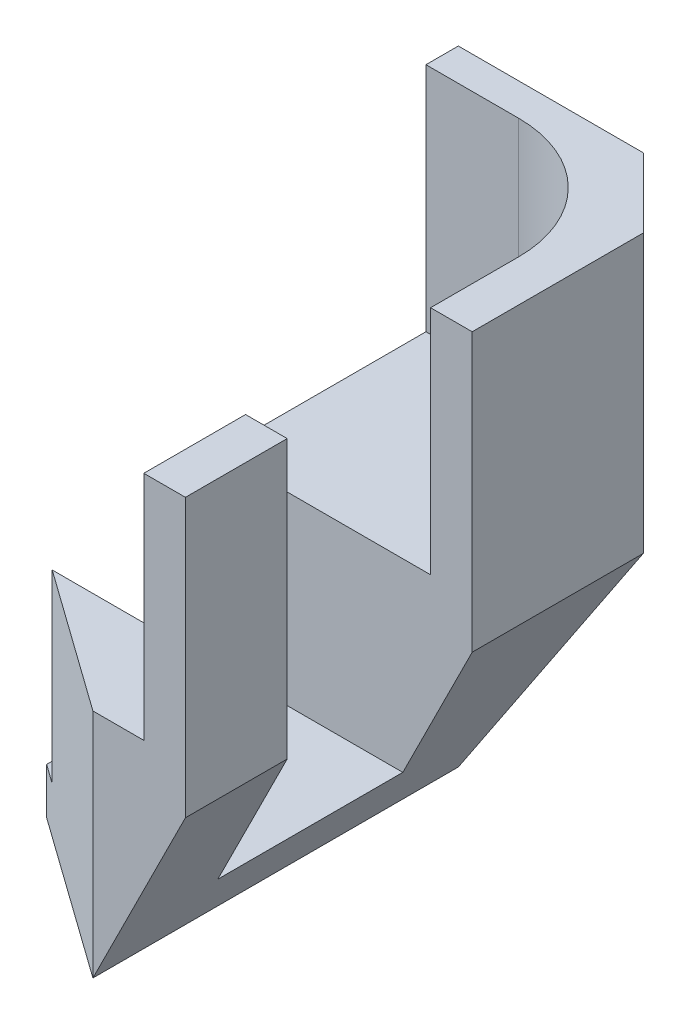
from build123d import *

# Parameters (mm, degrees)
SKETCH_1_R          = 2
EXTRUDE_1_DEPTH     = 50
CHAMFER_1_SIZE      = 15
EXTRUDE_2_DEPTH     = 50
CUT_EXTRUDE_START   = -40
SKETCH_3_W          = 55
SKETCH_3_H          = 40
CUT_EXTRUDE_1_DEPTH = 90
CUT_EXTRUDE_2_DEPTH = 156.630973781
CUT_EXTRUDE_3_DEPTH = 135.940727729
CHAMFER_2_SIZE      = 13.693
SKETCH_6_W          = 173.278000667
SKETCH_6_H          = 121.012081988
CUT_EXTRUDE_4_DEPTH = 55


# Read off the part's stored shape, not the designer's step: 镜向1
with BuildPart() as part:
    # 草图1 → 凸台-拉伸1 (new body)
    with BuildSketch(Plane(origin=(0, 0, 0), x_dir=(1, 0, 0), z_dir=(0, 1, 0))):
        Polygon((-35, 72), (-35, -42), (-15, -42), (20, -17), (20, 14.02557275), (20, 72), align=None)
        with Locations(Location((0, 0, 0), (0, 0, 270))):
            Circle(SKETCH_1_R, mode=Mode.SUBTRACT)
    extrude(amount=EXTRUDE_1_DEPTH)

    # 倒角1
    chamfer_1_edges = [part.edges().sort_by_distance(p)[0] for p in [
        (-35, 25, -72),
    ]]
    chamfer(chamfer_1_edges, length=CHAMFER_1_SIZE)

    # 草图2 → 凸台-拉伸2 (add)
    with BuildSketch(Plane(origin=(0, 50, 0), x_dir=(1, 0, 0), z_dir=(0, 1, 0))):
        with BuildLine():
            Line((-26, 39), (-26, -42))
            Line((-26, -42), (-35, -42))
            Line((-35, -42), (-35, 57))
            Line((-35, 57), (-20, 72))
            Line((-20, 72), (20, 72))
            Line((20, 72), (20, 65))
            Line((20, 65), (0, 65))
            ThreePointArc((0, 65), (-18.384776311, 57.384776311), (-26, 39))
        make_face()
    extrude(amount=EXTRUDE_2_DEPTH)

    # 草图3 → 切除-拉伸1 (cut)
    with BuildSketch(Plane(origin=(0, 50, 0), x_dir=(1, 0, 0), z_dir=(0, 1, 0)).offset(CUT_EXTRUDE_START)):
        with Locations((-7.5, 0)):
            Rectangle(SKETCH_3_W, SKETCH_3_H)
    extrude(amount=CUT_EXTRUDE_1_DEPTH, mode=Mode.SUBTRACT)

    # 草图4 → 切除-拉伸2 (cut, through all)
    with BuildSketch(Plane(origin=(0, 0, -72), x_dir=(-1, 0, 0), z_dir=(0, 0, -1))):
        Polygon((15, 0), (35, 40), (35, 0), align=None)
    extrude(amount=-CUT_EXTRUDE_2_DEPTH, mode=Mode.SUBTRACT)

    # 草图5 → 切除-拉伸3 (cut, through all)
    with BuildSketch(Plane(origin=(20, 0, 0), x_dir=(0, 0, -1), z_dir=(1, 0, 0))):
        Polygon((52, 0), (72, 0), (72, 40), align=None)
    extrude(amount=-CUT_EXTRUDE_3_DEPTH, mode=Mode.SUBTRACT)

    # 倒角2
    chamfer_2_edges = [part.edges().sort_by_distance(p)[0] for p in [
        (-21.25, 12.5, -58.25),
    ]]
    chamfer(chamfer_2_edges, length=CHAMFER_2_SIZE)

    # 镜向1: part across plane


with BuildPart() as part_1:
    add(part.part)
    add(part.part.mirror(Plane(origin=(20, 50, -14.02557275), x_dir=(0, 0, 1), z_dir=(-1, 0, 0))))

    # 草图6 → 切除-拉伸4 (cut)
    with BuildSketch(Plane.ZY.offset(35)):
        with Locations((-6.407902148, 50.117716033)):
            Rectangle(SKETCH_6_W, SKETCH_6_H)
    extrude(amount=-CUT_EXTRUDE_4_DEPTH, mode=Mode.SUBTRACT)


solid = part_1.part
